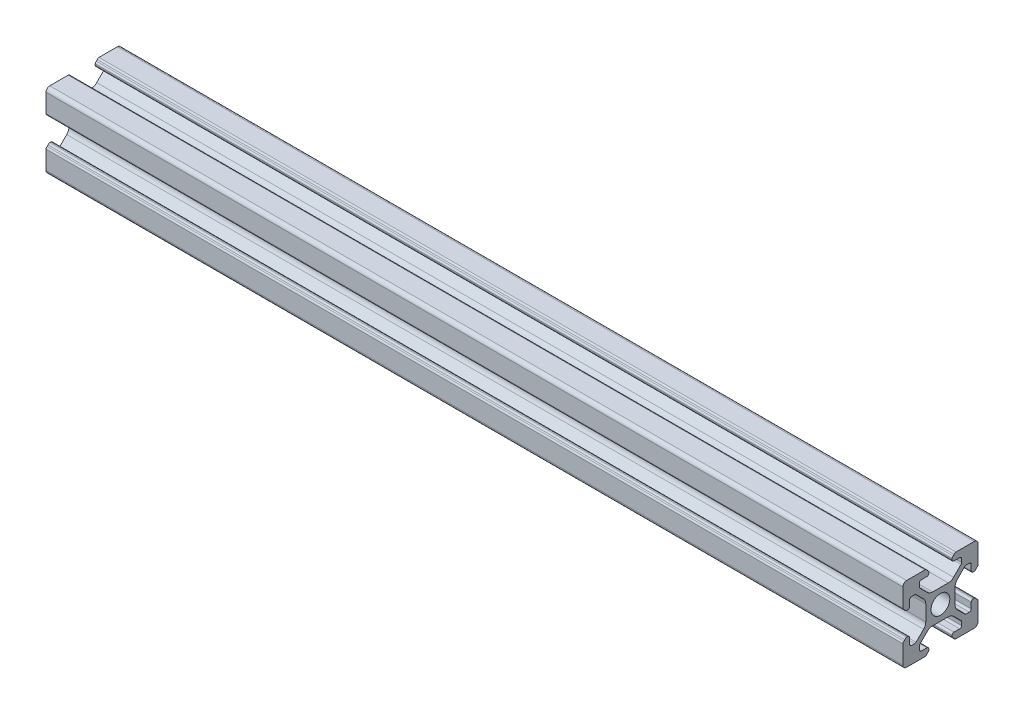
from build123d import *

# Parameters (mm, degrees)
SKETCH1_W                = 20
SKETCH1_H                = 20
BOSS_EXTRUDE1_DEPTH      = 228
FILLET1_R                = 1
CUT_EXTRUDE1_DEPTH       = 229.438175444
F_5_0_5_DIAMETER_HOLE1_D = 5
FILLET2_R                = 2
FILLET3_R                = 0.5
FILLET4_R                = 0.5
FILLET5_R                = 0.5


with BuildPart() as part:
    # Sketch1 → Boss-Extrude1 (new body)
    with BuildSketch(Plane(origin=(0, 0, 0), x_dir=(0, 0, -1), z_dir=(1, 0, 0))):
        Rectangle(SKETCH1_W, SKETCH1_H)
    extrude(amount=BOSS_EXTRUDE1_DEPTH)

    # Fillet1
    fillet1_edges = [part.edges().sort_by_distance(p)[0] for p in [
        (114, 10, 10),
        (114, 10, -10),
        (114, -10, -10),
        (114, -10, 10),
    ]]
    fillet(fillet1_edges, radius=FILLET1_R)

    # Sketch3 → Cut-Extrude1 (cut, through all)
    with BuildSketch(Plane.ZY):
        Polygon((-3.6, 10), (3.6, 10), (3.6, 9.5), (3.1, 9.5), (3.1, 8.2), (5.63, 8.2), (5.63, 6.619949494), (2.910050506, 3.9), (-2.910050506, 3.9), (-5.63, 6.619949494), (-5.63, 8.2), (-3.1, 8.2), (-3.1, 9.5), (-3.6, 9.5), align=None)
        Polygon((10, 3.6), (10, -3.6), (9.5, -3.6), (9.5, -3.1), (8.2, -3.1), (8.2, -5.63), (6.619949494, -5.63), (3.9, -2.910050506), (3.9, 2.910050506), (6.619949494, 5.63), (8.2, 5.63), (8.2, 3.1), (9.5, 3.1), (9.5, 3.6), align=None)
        Polygon((3.6, -10), (-3.6, -10), (-3.6, -9.5), (-3.1, -9.5), (-3.1, -8.2), (-5.63, -8.2), (-5.63, -6.619949494), (-2.910050506, -3.9), (2.910050506, -3.9), (5.63, -6.619949494), (5.63, -8.2), (3.1, -8.2), (3.1, -9.5), (3.6, -9.5), align=None)
        Polygon((-10, -3.6), (-10, 3.6), (-9.5, 3.6), (-9.5, 3.1), (-8.2, 3.1), (-8.2, 5.63), (-6.619949494, 5.63), (-3.9, 2.910050506), (-3.9, -2.910050506), (-6.619949494, -5.63), (-8.2, -5.63), (-8.2, -3.1), (-9.5, -3.1), (-9.5, -3.6), align=None)
    extrude(amount=-CUT_EXTRUDE1_DEPTH, mode=Mode.SUBTRACT)

    # Ø5.0 (5) Diameter Hole1 (through all)
    with Locations(Plane.ZY):
        with Locations((0, 0)):
            Hole(F_5_0_5_DIAMETER_HOLE1_D / 2)

    # Fillet2
    fillet2_edges = [part.edges().sort_by_distance(p)[0] for p in [
        (114, -3.9, -2.910050506),
        (114, -3.9, 2.910050506),
        (114, 2.910050506, -3.9),
        (114, -2.910050506, -3.9),
        (114, -2.910050506, 3.9),
        (114, 2.910050506, 3.9),
        (114, 3.9, 2.910050506),
        (114, 3.9, -2.910050506),
    ]]
    fillet(fillet2_edges, radius=FILLET2_R)

    # Fillet3
    fillet3_edges = [part.edges().sort_by_distance(p)[0] for p in [
        (114, 3.6, -10),
        (114, 3.1, -9.5),
        (114, 3.1, -8.2),
        (114, 5.63, -8.2),
        (114, 5.63, -6.619949494),
        (114, 3.6, 10),
        (114, 3.1, 9.5),
        (114, 3.1, 8.2),
        (114, 5.63, 8.2),
        (114, 5.63, 6.619949494),
        (114, 6.619949494, 5.63),
        (114, 8.2, 5.63),
        (114, 8.2, 3.1),
        (114, 9.5, 3.1),
        (114, 10, 3.6),
        (114, 9.5, -3.1),
        (114, 10, -3.6),
        (114, 8.2, -3.1),
        (114, 8.2, -5.63),
        (114, 6.619949494, -5.63),
    ]]
    fillet(fillet3_edges, radius=FILLET3_R - 0.0001)  # a hair under: the kernel refuses the full size

    # Fillet4
    fillet4_edges = [part.edges().sort_by_distance(p)[0] for p in [
        (114, -3.6, 10),
        (114, -3.1, 9.5),
        (114, -3.1, 8.2),
        (114, -5.63, 8.2),
        (114, -5.63, 6.619949494),
        (114, -6.619949494, 5.63),
        (114, -8.2, 5.63),
        (114, -8.2, 3.1),
        (114, -10, 3.6),
        (114, -9.5, 3.1),
        (114, -10, -3.6),
        (114, -9.5, -3.1),
        (114, -8.2, -3.1),
        (114, -8.2, -5.63),
        (114, -6.619949494, -5.63),
        (114, -5.63, -6.619949494),
        (114, -5.63, -8.2),
        (114, -3.1, -8.2),
        (114, -3.1, -9.5),
        (114, -3.6, -10),
    ]]
    fillet(fillet4_edges, radius=FILLET4_R - 0.0001)  # a hair under: the kernel refuses the full size

    # Fillet5
    fillet5_edges = [part.edges().sort_by_distance(p)[0] for p in [
        (114, 3.6, 9.5),
        (114, 9.5, 3.6),
        (114, 9.5, -3.6),
        (114, 3.6, -9.5),
        (114, -3.6, 9.5),
        (114, -9.5, 3.6),
        (114, -9.5, -3.6),
        (114, -3.6, -9.5),
    ]]
    fillet(fillet5_edges, radius=FILLET5_R)


solid = part.part
